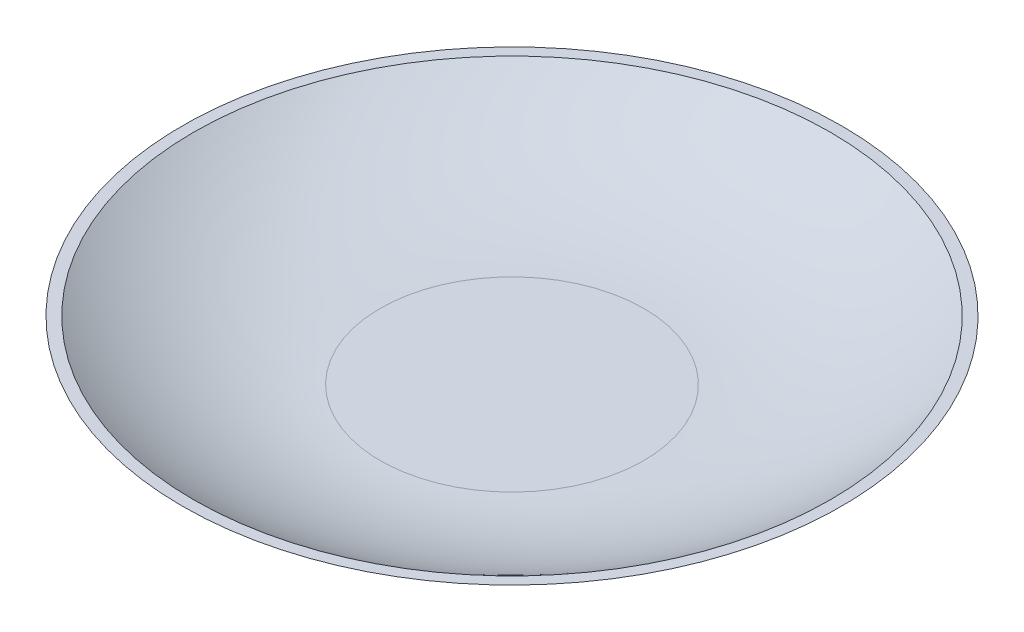
from build123d import *

# Parameters (mm, degrees)
SKETCH1_R           = 2500
BOSS_EXTRUDE1_DEPTH = 500
FILLET1_R           = 2500
SHELL1_T            = -50


with BuildPart() as part:
    # Sketch1 → Boss-Extrude1 (new body)
    with BuildSketch(Plane(origin=(0, 0, 0), x_dir=(1, 0, 0), z_dir=(0, 1, 0))):
        with Locations(Location((0, 0, 0), (0, 0, 270))):
            Circle(SKETCH1_R)
    extrude(amount=-BOSS_EXTRUDE1_DEPTH)

    # Fillet1
    # the kernel refuses this fillet: 2500 mm, written as the material it takes off along each edge
    with BuildSketch(Plane(origin=(0, -500, 0), x_dir=(0, 0, 1), z_dir=(-1, 0, 0))) as fillet1_piece_1:
        with BuildLine():
            CenterArc((1000, 2500), FILLET1_R, 270, 36.869897646)
            Line((1000, 0), (1000, -50))
            Line((1000, -50), (2500, -50))
            Line((2500, -50), (2550, 0))
            ThreePointArc((2550, 0), (2550, 250), (2530, 460))
            Line((2530, 460), (2500, 500))
        make_face()
    revolve(axis=Axis((0, -500, 0), (0, 1, 0)), mode=Mode.SUBTRACT)

    # Shell1
    shell1_openings = [part.faces().sort_by_distance(p)[0] for p in [
        (0, 0, 0),
    ]]
    offset(amount=SHELL1_T, openings=shell1_openings, kind=Kind.INTERSECTION)


solid = part.part
